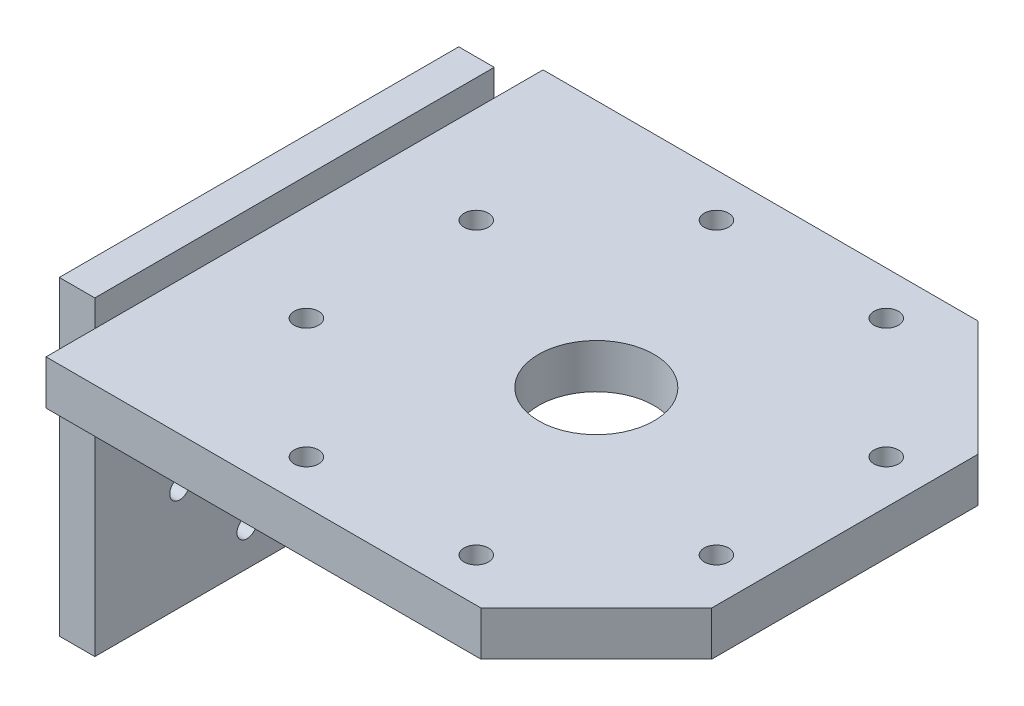
from build123d import *

# Parameters (mm, degrees)
SK_BACK_PLATE_W         = 90
SK_BACK_PLATE_H         = 70
SK_BACK_PLATE_R         = 2.25
SK_BACK_PLATE_R_2       = 6
BACK_PLATE_DEPTH        = 8
SK_ROLL_PILOT_RECESS_R  = 22.15
ROLL_PILOT_RECESS_DEPTH = 2.2
SK_MEDIAL_PLATE_R       = 2.75
SK_MEDIAL_PLATE_R_2     = 13
MEDIAL_PLATE_DEPTH      = 10


with BuildPart() as part:
    # SK_Back_Plate → Back_Plate (new body)
    with BuildSketch(Plane(origin=(-76, 0, 0), x_dir=(0, 0, -1), z_dir=(1, 0, 0))):
        with Locations((0, 1)):
            Rectangle(SK_BACK_PLATE_W, SK_BACK_PLATE_H)
        with Locations((25.86862691, -10.715136106)):
            Circle(SK_BACK_PLATE_R, mode=Mode.SUBTRACT)
        with Locations((10.715136106, -25.86862691)):
            Circle(SK_BACK_PLATE_R, mode=Mode.SUBTRACT)
        with Locations((-10.715136106, -25.86862691)):
            Circle(SK_BACK_PLATE_R, mode=Mode.SUBTRACT)
        with Locations((-25.86862691, -10.715136106)):
            Circle(SK_BACK_PLATE_R, mode=Mode.SUBTRACT)
        with Locations((-25.86862691, 10.715136106)):
            Circle(SK_BACK_PLATE_R, mode=Mode.SUBTRACT)
        with Locations((-10.715136106, 25.86862691)):
            Circle(SK_BACK_PLATE_R, mode=Mode.SUBTRACT)
        with Locations((10.715136106, 25.86862691)):
            Circle(SK_BACK_PLATE_R, mode=Mode.SUBTRACT)
        with Locations((25.86862691, 10.715136106)):
            Circle(SK_BACK_PLATE_R, mode=Mode.SUBTRACT)
        Circle(SK_BACK_PLATE_R_2, mode=Mode.SUBTRACT)
    extrude(amount=BACK_PLATE_DEPTH)

    # SK_Roll_Pilot_Recess → Roll_Pilot_Recess (cut)
    with BuildSketch(Plane(origin=(-76, 0, 0), x_dir=(0, 0, -1), z_dir=(1, 0, 0))):
        Circle(SK_ROLL_PILOT_RECESS_R)
    extrude(amount=ROLL_PILOT_RECESS_DEPTH, mode=Mode.SUBTRACT)

    # SK_Medial_Plate → Medial_Plate (add)
    with BuildSketch(Plane(origin=(0, 20, 0), x_dir=(1, 0, 0), z_dir=(0, 1, 0))):
        Polygon((-68, 56), (30, 56), (56, 30), (56, -30), (30, -56), (-68, -56), align=None)
        with Locations((46.193976626, 19.134171618)):
            Circle(SK_MEDIAL_PLATE_R, mode=Mode.SUBTRACT)
        with Locations((19.134171618, 46.193976626)):
            Circle(SK_MEDIAL_PLATE_R, mode=Mode.SUBTRACT)
        with Locations((-19.134171618, 46.193976626)):
            Circle(SK_MEDIAL_PLATE_R, mode=Mode.SUBTRACT)
        with Locations((-46.193976626, 19.134171618)):
            Circle(SK_MEDIAL_PLATE_R, mode=Mode.SUBTRACT)
        with Locations((-46.193976626, -19.134171618)):
            Circle(SK_MEDIAL_PLATE_R, mode=Mode.SUBTRACT)
        with Locations((-19.134171618, -46.193976626)):
            Circle(SK_MEDIAL_PLATE_R, mode=Mode.SUBTRACT)
        with Locations((19.134171618, -46.193976626)):
            Circle(SK_MEDIAL_PLATE_R, mode=Mode.SUBTRACT)
        with Locations((46.193976626, -19.134171618)):
            Circle(SK_MEDIAL_PLATE_R, mode=Mode.SUBTRACT)
        Circle(SK_MEDIAL_PLATE_R_2, mode=Mode.SUBTRACT)
    extrude(amount=MEDIAL_PLATE_DEPTH)


solid = part.part
